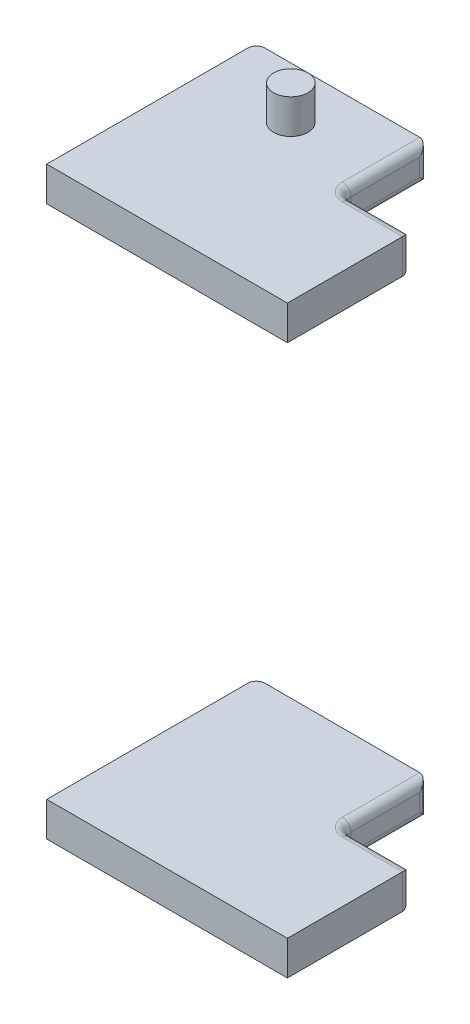
from build123d import *

# Parameters (mm, degrees)
SKETCH1_W            = 140
SKETCH1_H            = 121.955
BOSS_EXTRUDE1_DEPTH  = 20
SKETCH2_W            = 40
SKETCH2_H            = 50
CUT_EXTRUDE1_DEPTH   = 180.164728672
SKETCH3_W            = 10
SKETCH3_H            = 20
FILLET1_R            = 5
REVOLVE2_START       = -170
REVOLVE2_DEPTH       = 20
REVOLVE2_START_2     = -190
REVOLVE2_2_OUTLINE_R = 10
REVOLVE2_2_DEPTH     = 20
REVOLVE2_START_3     = 104.9999999
REVOLVE2_4_DEPTH     = 36.0000001
REVOLVE2_START_4     = -111
REVOLVE2_5_DEPTH     = 46


with BuildPart() as part:
    # Sketch1 → Boss-Extrude1 (new body)
    with BuildSketch(Plane(origin=(0, 170, 0), x_dir=(1, 0, 0), z_dir=(0, 1, 0))):
        with Locations((70, 49.0225)):
            Rectangle(SKETCH1_W, SKETCH1_H)
    extrude(amount=-BOSS_EXTRUDE1_DEPTH)

    # Sketch2 → Cut-Extrude1 (cut, through all)
    with BuildSketch(Plane.XZ.offset(-150)):
        with Locations((120, -85)):
            Rectangle(SKETCH2_W, SKETCH2_H)
    extrude(amount=-CUT_EXTRUDE1_DEPTH, mode=Mode.SUBTRACT)

    # Sketch3 → Revolve1 (revolve)
    with BuildSketch(Plane(origin=(0, 0, -80), x_dir=(-1, 0, 0), z_dir=(0, 0, -1)), mode=Mode.PRIVATE) as revolve1_sk:
        with Locations((-55, 180)):
            Rectangle(SKETCH3_W, SKETCH3_H)
    revolve(revolve1_sk.sketch.rotate(Axis((50, 170, -80), (0, 1, 0)), 270), axis=Axis((50, 170, -80), (0, 1, 0)))

    # Fillet1
    fillet1_edges = [part.edges().sort_by_distance(p)[0] for p in [
        (140, 160, -60),
        (100, 170, -85),
        (100, 160, -110),
        (120, 170, -60),
        (100, 160, -60),
        (120, 150, -60),
        (100, 150, -85),
        (0, 160, -110),
    ]]
    fillet(fillet1_edges, radius=FILLET1_R)


with BuildPart() as body_2:
    # Revolve2: read off the stored shape, not the designer's step
    # Revolve2 outline → Revolve2 (new body)
    with BuildSketch(Plane(origin=(0, 0, 0), x_dir=(1, 0, 0), z_dir=(0, 1, 0)).offset(REVOLVE2_START)):
        with BuildLine():
            Line((135, 60), (105, 60))
            ThreePointArc((105, 60), (101.464466094, 61.464466094), (100, 65))
            Line((100, 65), (100, 105))
            ThreePointArc((100, 105), (98.535533906, 108.535533906), (95, 110))
            Line((95, 110), (5, 110))
            ThreePointArc((5, 110), (1.464466094, 108.535533906), (0, 105))
            Line((0, 105), (0, -11.955))
            Line((0, -11.955), (140, -11.955))
            Line((140, -11.955), (140, 55))
            ThreePointArc((140, 55), (138.535533906, 58.535533906), (135, 60))
        make_face()
    extrude(amount=REVOLVE2_DEPTH)

    # Revolve2 2 outline → Revolve2 2 (add)
    with BuildSketch(Plane(origin=(0, 0, 0), x_dir=(1, 0, 0), z_dir=(0, 1, 0)).offset(REVOLVE2_START_2)):
        with Locations((50, 80)):
            Circle(REVOLVE2_2_OUTLINE_R)
    extrude(amount=REVOLVE2_2_DEPTH)

    # Revolve2 3 outline → Revolve2 3 (revolve, cut)
    with BuildSketch(Plane(origin=(105, 0, -65), x_dir=(1, 0, 0), z_dir=(0, 0, 1))):
        with BuildLine():
            ThreePointArc((10, -170), (6.464466094, -168.535533906), (5, -165))
            Line((5, -165), (5, -170))
            Line((5, -170), (10, -170))
        make_face()
        with BuildLine():
            Line((5, -150), (5, -155))
            ThreePointArc((5, -155), (6.464466094, -151.464466094), (10, -150))
            Line((10, -150), (5, -150))
        make_face()
    revolve(axis=Axis((105, 0, -65), (0, 1, 0)), mode=Mode.SUBTRACT)

    # Revolve2 4 outline → Revolve2 4 (cut)
    with BuildSketch(Plane.YZ.offset(REVOLVE2_START_3)):
        with BuildLine():
            ThreePointArc((-150, -55), (-151.464466094, -58.535533906), (-155, -60))
            Line((-155, -60), (-150, -60))
            Line((-150, -60), (-150, -55))
        make_face()
        with BuildLine():
            ThreePointArc((-165, -60), (-168.535533906, -58.535533906), (-170, -55))
            Line((-170, -55), (-170, -60))
            Line((-170, -60), (-165, -60))
        make_face()
    extrude(amount=REVOLVE2_4_DEPTH, mode=Mode.SUBTRACT)

    # Revolve2 5 outline → Revolve2 5 (cut)
    with BuildSketch(Plane.XY.offset(REVOLVE2_START_4)):
        with BuildLine():
            Line((100, -170), (100, -165))
            ThreePointArc((100, -165), (98.535533906, -168.535533906), (95, -170))
            Line((95, -170), (100, -170))
        make_face()
        with BuildLine():
            ThreePointArc((95, -150), (98.535533906, -151.464466094), (100, -155))
            Line((100, -155), (100, -150))
            Line((100, -150), (95, -150))
        make_face()
    extrude(amount=REVOLVE2_5_DEPTH, mode=Mode.SUBTRACT)


solid = Compound([part.part, body_2.part])
